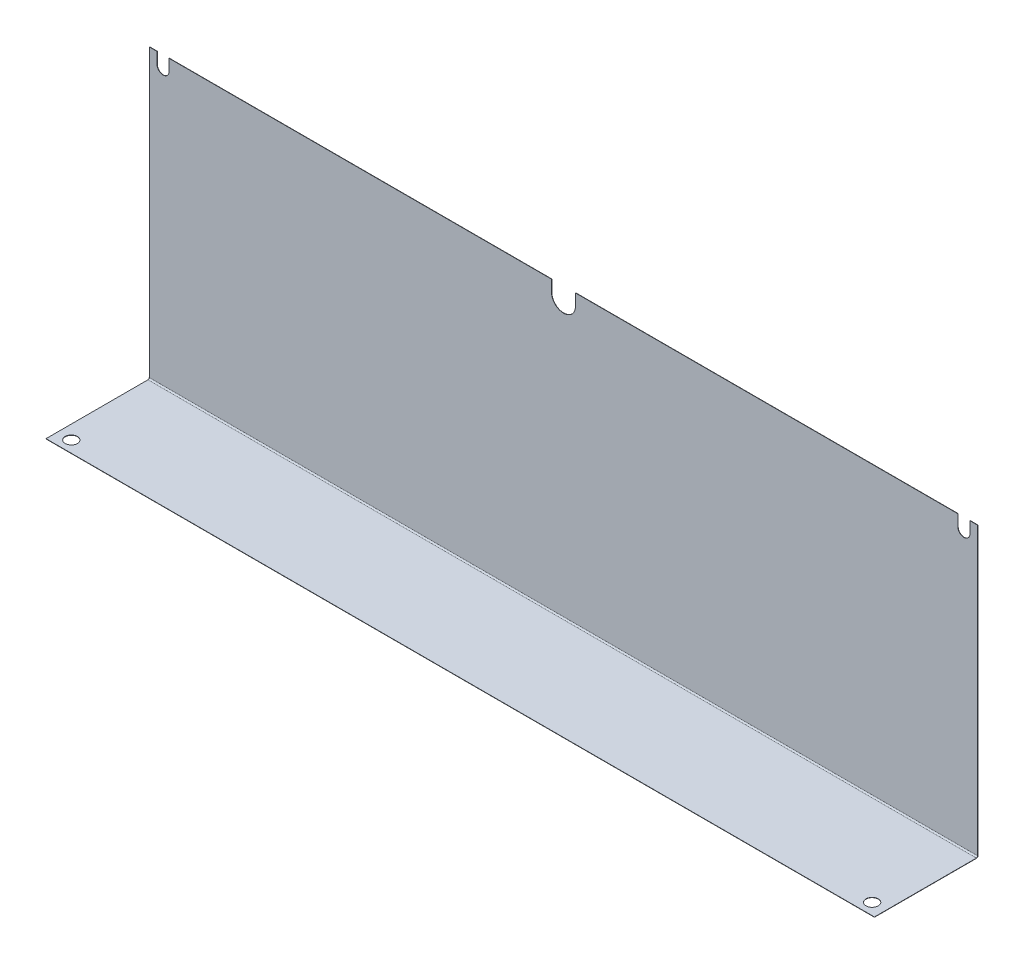
from build123d import *

# Parameters (mm, degrees)
SKETCH1_W                    = 457.2
SKETCH1_H                    = 57.15
BASE_FLANGE1_DEPTH           = 0.15875
EDGE_FLANGE1_STRIP_W         = 2.1082
EDGE_FLANGE1_STRIP_H         = 0.15875
EDGE_FLANGE1_STRIP_CUT_DEPTH = 457.2
EDGE_FLANGE1_DEPTH           = 457.2
CUT_EXTRUDE1_DEPTH           = 488.3392299
F_1_4_CLEARANCE_HOLE2_D      = 6.7564
F_1_4_CLEARANCE_HOLE2_DEPTH  = 25.4
F_1_4_CLEARANCE_HOLE2_TIP    = 2.029827343


# Sheet-metal steps are written as plain solids
with BuildPart() as part:
    # Sketch1 → Base-Flange1 (new body)
    with BuildSketch(Plane(origin=(0, 0, 0), x_dir=(1, 0, 0), z_dir=(0, 1, 0))):
        with Locations((228.6, 28.575)):
            Rectangle(SKETCH1_W, SKETCH1_H)
    extrude(amount=-BASE_FLANGE1_DEPTH)

    # Edge-Flange1 strip (across the edge) → Edge-Flange1 strip cut (cut)
    with BuildSketch(Plane(origin=(457.2, 0, -57.15), x_dir=(0, 0, 1), z_dir=(-1, 0, 0))):
        with Locations((-0.15875, -0.079375)):
            Rectangle(EDGE_FLANGE1_STRIP_W, EDGE_FLANGE1_STRIP_H)
    extrude(amount=EDGE_FLANGE1_STRIP_CUT_DEPTH, mode=Mode.SUBTRACT)

    # Edge-Flange1 section (across the edge) → Edge-Flange1 (add)
    with BuildSketch(Plane(origin=(457.2, 0, -57.15), x_dir=(0, 0, 1), z_dir=(-1, 0, 0))):
        with BuildLine():
            Line((0, 0.7366), (0, 158.75))
            Line((0, 158.75), (0.15875, 158.75))
            Line((0.15875, 158.75), (0.15875, 0.7366))
            ThreePointArc((0.15875, 0.7366), (0.374495145, 0.215745145), (0.89535, 0))
            Line((0.89535, 0), (0.89535, -0.15875))
            ThreePointArc((0.89535, -0.15875), (0.262241943, 0.103491943), (0, 0.7366))
        make_face()
    extrude(amount=EDGE_FLANGE1_DEPTH)

    # Sketch9 → Cut-Extrude1 (cut, through all)
    with BuildSketch(Plane(origin=(0, 0, -57.15), x_dir=(-1, 0, 0), z_dir=(0, 0, -1))):
        with BuildLine():
            Line((-446.278, 152.4), (-446.278, 158.75))
            Line((-446.278, 158.75), (-452.882, 158.75))
            Line((-452.882, 158.75), (-452.882, 152.4))
            ThreePointArc((-452.882, 152.4), (-449.58, 149.098), (-446.278, 152.4))
        make_face()
        with BuildLine():
            Line((-10.922, 152.4), (-10.922, 158.75))
            Line((-10.922, 158.75), (-4.318, 158.75))
            Line((-4.318, 158.75), (-4.318, 152.4))
            ThreePointArc((-4.318, 152.4), (-7.62, 149.098), (-10.922, 152.4))
        make_face()
        with BuildLine():
            Line((-235.204, 152.4), (-235.204, 158.75))
            Line((-235.204, 158.75), (-221.996, 158.75))
            Line((-221.996, 158.75), (-221.996, 152.4))
            ThreePointArc((-221.996, 152.4), (-228.6, 145.796), (-235.204, 152.4))
        make_face()
    extrude(amount=-CUT_EXTRUDE1_DEPTH, mode=Mode.SUBTRACT)

    # 1/4 Clearance Hole2
    with Locations(Plane(origin=(7.62, -0.15875, -6.35), x_dir=(0, 0, -1), z_dir=(0, -1, 0))):
        with Locations((0, 0), (0, 441.96)):
            Hole(F_1_4_CLEARANCE_HOLE2_D / 2, depth=F_1_4_CLEARANCE_HOLE2_DEPTH)
            with Locations((0, 0, -(F_1_4_CLEARANCE_HOLE2_DEPTH + F_1_4_CLEARANCE_HOLE2_TIP / 2))):  # 118° drill point
                Cone(0, F_1_4_CLEARANCE_HOLE2_D / 2, F_1_4_CLEARANCE_HOLE2_TIP, mode=Mode.SUBTRACT)


solid = part.part
